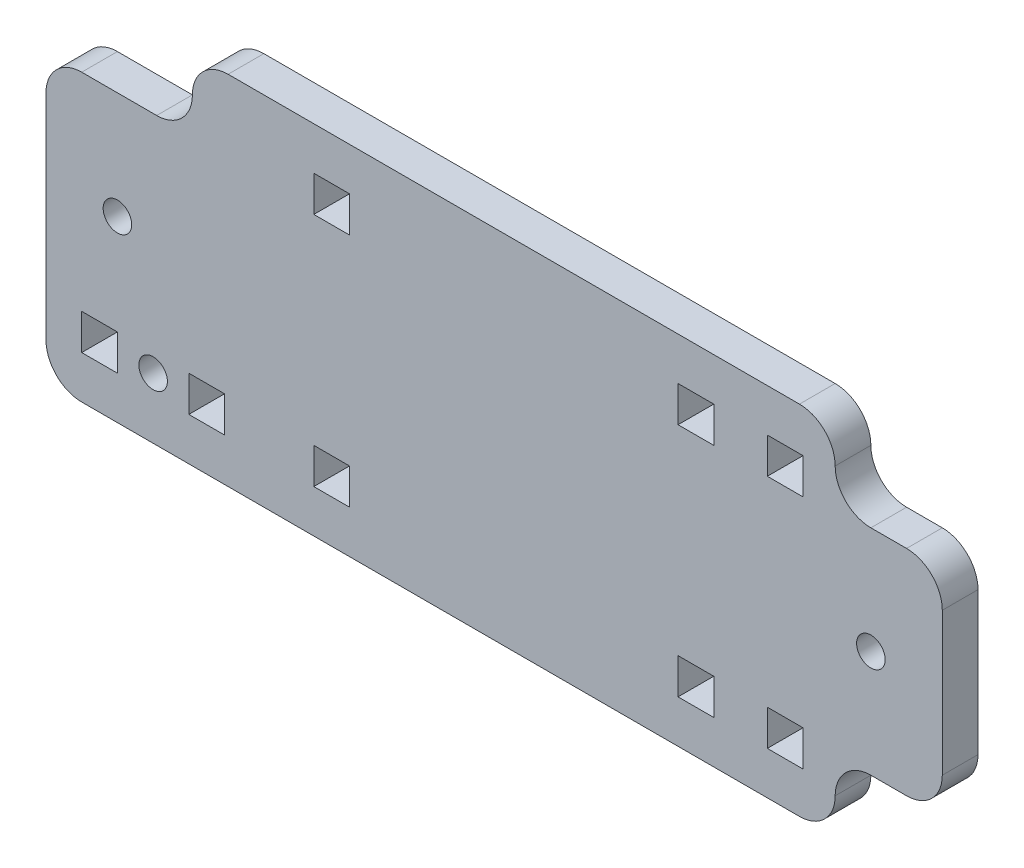
from build123d import *

# Parameters (mm, degrees)
ESQUISSE1_R        = 2
ESQUISSE1_W        = 5
ESQUISSE1_H        = 5
BOSS_EXTRU_1_DEPTH = 5
CONG_1_R           = 5


with BuildPart() as part:
    # Esquisse1 → Boss.-Extru.1 (new body)
    with BuildSketch(Plane.XY):
        Polygon((15, 30), (15, 40), (105, 40), (105, 30), (120, 30), (120, 0), (105, 0), (105, -10), (15, -10), (-5.5, -10), (-5.5, 30), (0, 30), align=None)
        with Locations(Location((110, 15, 0), (0, 0, 180))):
            Circle(ESQUISSE1_R, mode=Mode.SUBTRACT)
        with Locations((4.5, 15)):
            Circle(ESQUISSE1_R, mode=Mode.SUBTRACT)
        with Locations((9.5, -1.5)):
            Circle(ESQUISSE1_R, mode=Mode.SUBTRACT)
        with Locations((85.5, 31.5)):
            Rectangle(ESQUISSE1_W, ESQUISSE1_H, mode=Mode.SUBTRACT)
        with Locations((34.5, 31.5)):
            Rectangle(ESQUISSE1_W, ESQUISSE1_H, mode=Mode.SUBTRACT)
        with Locations((85.5, -1.5)):
            Rectangle(ESQUISSE1_W, ESQUISSE1_H, mode=Mode.SUBTRACT)
        with Locations((34.5, -1.5)):
            Rectangle(ESQUISSE1_W, ESQUISSE1_H, mode=Mode.SUBTRACT)
        with Locations((98, -1.5)):
            Rectangle(ESQUISSE1_W, ESQUISSE1_H, mode=Mode.SUBTRACT)
        with Locations((98, 31.5)):
            Rectangle(ESQUISSE1_W, ESQUISSE1_H, mode=Mode.SUBTRACT)
        with Locations((2, -1.5)):
            Rectangle(ESQUISSE1_W, ESQUISSE1_H, mode=Mode.SUBTRACT)
        with Locations((17, -1.5)):
            Rectangle(ESQUISSE1_W, ESQUISSE1_H, mode=Mode.SUBTRACT)
    extrude(amount=BOSS_EXTRU_1_DEPTH)

    # Congé1
    cong_1_edges = [part.edges().sort_by_distance(p)[0] for p in [
        (105, -10, 2.5),
        (105, 0, 2.5),
        (120, 0, 2.5),
        (120, 30, 2.5),
        (105, 30, 2.5),
        (105, 40, 2.5),
        (15, 40, 2.5),
        (15, 30, 2.5),
        (-5.5, -10, 2.5),
        (-5.5, 30, 2.5),
    ]]
    fillet(cong_1_edges, radius=CONG_1_R - 0.0001)  # a hair under: the kernel refuses the full size


solid = part.part
